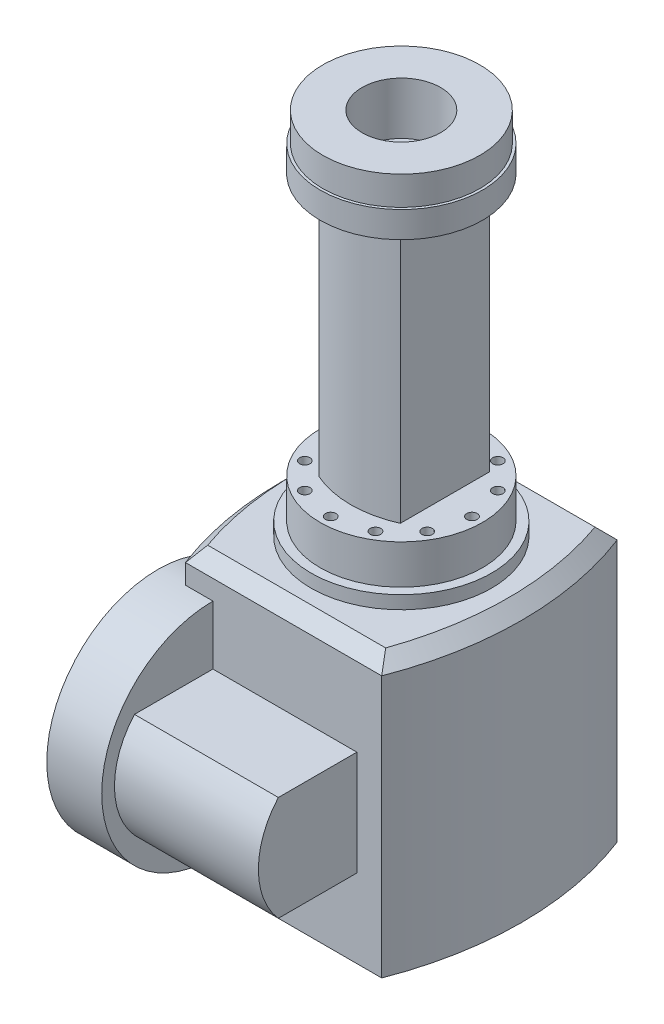
from build123d import *

# Parameters (mm, degrees)
Y_KSEKLIK_EKSTR_ZYON1_DEPTH = 100
Y_KSEKLIK_EKSTR_ZYON2_DEPTH = 5
Y_KSEKLIK_EKSTR_ZYON2_DRAFT = 45
IZIM6_R                     = 34.5
Y_KSEKLIK_EKSTR_ZYON3_DEPTH = 5
IZIM7_R                     = 31
Y_KSEKLIK_EKSTR_ZYON4_DEPTH = 15
IZIM8_R                     = 2
KES_EKSTR_ZYON1_DEPTH       = 5
DAIRESEL_KAPLAMA1_COUNT     = 12
Y_KSEKLIK_EKSTR_ZYON5_DEPTH = 100
Y_KSEKLIK_EKSTR_ZYON6_START = 10
IZIM11_R                    = 31
Y_KSEKLIK_EKSTR_ZYON6_DEPTH = 10
IZIM12_R                    = 30
Y_KSEKLIK_EKSTR_ZYON7_DEPTH = 11
IZIM13_R                    = 42.5
Y_KSEKLIK_EKSTR_ZYON8_DEPTH = 10.5
Y_KSEKLIK_EKSTR_ZYON9_DEPTH = 55
IZIM17_R                    = 15
KES_EKSTR_ZYON2_DEPTH       = 20
IZIM18_R                    = 15
KES_EKSTR_ZYON3_DEPTH       = 20


# Read off the part's stored shape, not the designer's step: Yükseklik-Ekstrüzyon2
with BuildPart() as part:
    # Çizim1 → Yükseklik-Ekstrüzyon1 (new body)
    with BuildSketch(Plane(origin=(0, 0, 0), x_dir=(1, 0, 0), z_dir=(0, 1, 0))):
        with BuildLine():
            Line((-37.5, 45), (37.5, 45))
            ThreePointArc((37.5, 45), (45.880962103, 0), (37.5, -45))
            Line((37.5, -45), (-37.5, -45))
            ThreePointArc((-37.5, -45), (-45.880962103, 0), (-37.5, 45))
        make_face()
    extrude(amount=-Y_KSEKLIK_EKSTR_ZYON1_DEPTH)


with BuildPart() as y_kseklik_ekstr_zyon2_tool:
    # Yükseklik-Ekstrüzyon2 outline → Yükseklik-Ekstrüzyon2 (with draft: the straight prism first)
    with BuildSketch(Plane(origin=(0, 5, 0), x_dir=(1, 0, 0), z_dir=(0, 1, 0))):
        with BuildLine():
            ThreePointArc((-34.018047093, 40), (-40.880962103, 0), (-34.018047093, -40))
            Line((-34.018047093, -40), (34.018047093, -40))
            ThreePointArc((34.018047093, -40), (40.880962103, 0), (34.018047093, 40))
            Line((34.018047093, 40), (-34.018047093, 40))
        make_face()
    extrude(amount=-Y_KSEKLIK_EKSTR_ZYON2_DEPTH)
    # Yükseklik-Ekstrüzyon2: the draft: its side faces are tilted about the plane it starts from
    y_kseklik_ekstr_zyon2_sides = [y_kseklik_ekstr_zyon2_tool.faces().sort_by_distance(p)[0] for p in [
        (0, 2.5, -40),
        (-40.880962103, 2.5, 0),
        (0, 2.5, 40),
        (40.880962103, 2.5, 0),
    ]]
    draft(y_kseklik_ekstr_zyon2_sides, Plane(origin=(0, 5, 0), x_dir=(1, 0, 0), z_dir=(0, 1, 0)), Y_KSEKLIK_EKSTR_ZYON2_DRAFT)


with BuildPart() as part_1:
    add(part.part)

    # Yükseklik-Ekstrüzyon2: add y_kseklik_ekstr_zyon2_tool
    add(y_kseklik_ekstr_zyon2_tool.part)

    # Çizim6 → Yükseklik-Ekstrüzyon3 (add, symmetric)
    with BuildSketch(Plane(origin=(0, 5, 0), x_dir=(1, 0, 0), z_dir=(0, 1, 0))):
        with Locations(Location((0, 0, 0), (0, 0, 270))):
            Circle(IZIM6_R)
    extrude(amount=Y_KSEKLIK_EKSTR_ZYON3_DEPTH, both=True)

    # Çizim7 → Yükseklik-Ekstrüzyon4 (add, symmetric)
    with BuildSketch(Plane(origin=(0, 10, 0), x_dir=(1, 0, 0), z_dir=(0, 1, 0))):
        with Locations(Location((0, 0, 0), (0, 0, 270))):
            Circle(IZIM7_R)
    extrude(amount=Y_KSEKLIK_EKSTR_ZYON4_DEPTH, both=True)

    # Çizim8 → Kes-Ekstrüzyon1 (cut)
    with BuildSketch(Plane(origin=(0, 25, 0), x_dir=(1, 0, 0), z_dir=(0, 1, 0))):
        with Locations(Location((27, 0, 0), (0, 0, 270))):
            Circle(IZIM8_R)
    kes_ekstr_zyon1 = extrude(amount=-KES_EKSTR_ZYON1_DEPTH, mode=Mode.SUBTRACT)

    # Dairesel Kaplama1: Kes-Ekstrüzyon1 ×12 about axis
    dairesel_kaplama1_axis = Axis((0, 0, 0), (0, 1, 0))
    for i in range(1, DAIRESEL_KAPLAMA1_COUNT):
        add(kes_ekstr_zyon1.rotate(dairesel_kaplama1_axis, i * 360 / DAIRESEL_KAPLAMA1_COUNT), mode=Mode.SUBTRACT)

    # Çizim10 → Yükseklik-Ekstrüzyon5 (add)
    with BuildSketch(Plane(origin=(0, 25, 0), x_dir=(1, 0, 0), z_dir=(0, 1, 0))):
        with BuildLine():
            Line((-15.581702618, -15.971995333), (-15.581702618, 18.028004667))
            ThreePointArc((-15.581702618, 18.028004667), (0, 21.342270575), (15.581702618, 18.028004667))
            Line((15.581702618, 18.028004667), (15.581702618, -15.971995333))
            ThreePointArc((15.581702618, -15.971995333), (0, -19.28626124), (-15.581702618, -15.971995333))
        make_face()
    extrude(amount=Y_KSEKLIK_EKSTR_ZYON5_DEPTH)

    # Çizim11 → Yükseklik-Ekstrüzyon6 (add)
    with BuildSketch(Plane(origin=(0, 125, 0), x_dir=(1, 0, 0), z_dir=(0, 1, 0)).offset(Y_KSEKLIK_EKSTR_ZYON6_START)):
        with Locations(Location((0, 0, 0), (0, 0, 270))):
            Circle(IZIM11_R)
    extrude(amount=-Y_KSEKLIK_EKSTR_ZYON6_DEPTH)

    # Çizim12 → Yükseklik-Ekstrüzyon7 (add)
    with BuildSketch(Plane(origin=(0, 135, 0), x_dir=(1, 0, 0), z_dir=(0, 1, 0))):
        with Locations(Location((0, 0, 0), (0, 0, 270))):
            Circle(IZIM12_R)
    extrude(amount=Y_KSEKLIK_EKSTR_ZYON7_DEPTH)

    # Çizim13 → Yükseklik-Ekstrüzyon8 (add, symmetric)
    with BuildSketch(Plane.ZY.offset(37.5)):
        with Locations(Location((45, -50, 0), (0, 0, 270))):
            Circle(IZIM13_R)
    extrude(amount=Y_KSEKLIK_EKSTR_ZYON8_DEPTH, both=True)

    # Çizim16 → Yükseklik-Ekstrüzyon9 (add)
    with BuildSketch(Plane(origin=(-27, 0, 0), x_dir=(0, 0, -1), z_dir=(1, 0, 0))):
        with BuildLine():
            Line((-45, -30), (-45, -70))
            Line((-45, -70), (-75, -70))
            ThreePointArc((-75, -70), (-82.639320225, -50), (-75, -30))
            Line((-75, -30), (-45, -30))
        make_face()
    extrude(amount=Y_KSEKLIK_EKSTR_ZYON9_DEPTH)

    # Çizim17 → Kes-Ekstrüzyon2 (cut)
    with BuildSketch(Plane(origin=(0, 146, 0), x_dir=(1, 0, 0), z_dir=(0, 1, 0))):
        with Locations(Location((0, 0, 0), (0, 0, 270))):
            Circle(IZIM17_R)
    extrude(amount=-KES_EKSTR_ZYON2_DEPTH, mode=Mode.SUBTRACT)

    # Çizim18 → Kes-Ekstrüzyon3 (cut)
    with BuildSketch(Plane.ZY.offset(48)):
        with Locations(Location((45, -50, 0), (0, 0, 270))):
            Circle(IZIM18_R)
    extrude(amount=-KES_EKSTR_ZYON3_DEPTH, mode=Mode.SUBTRACT)


solid = part_1.part
